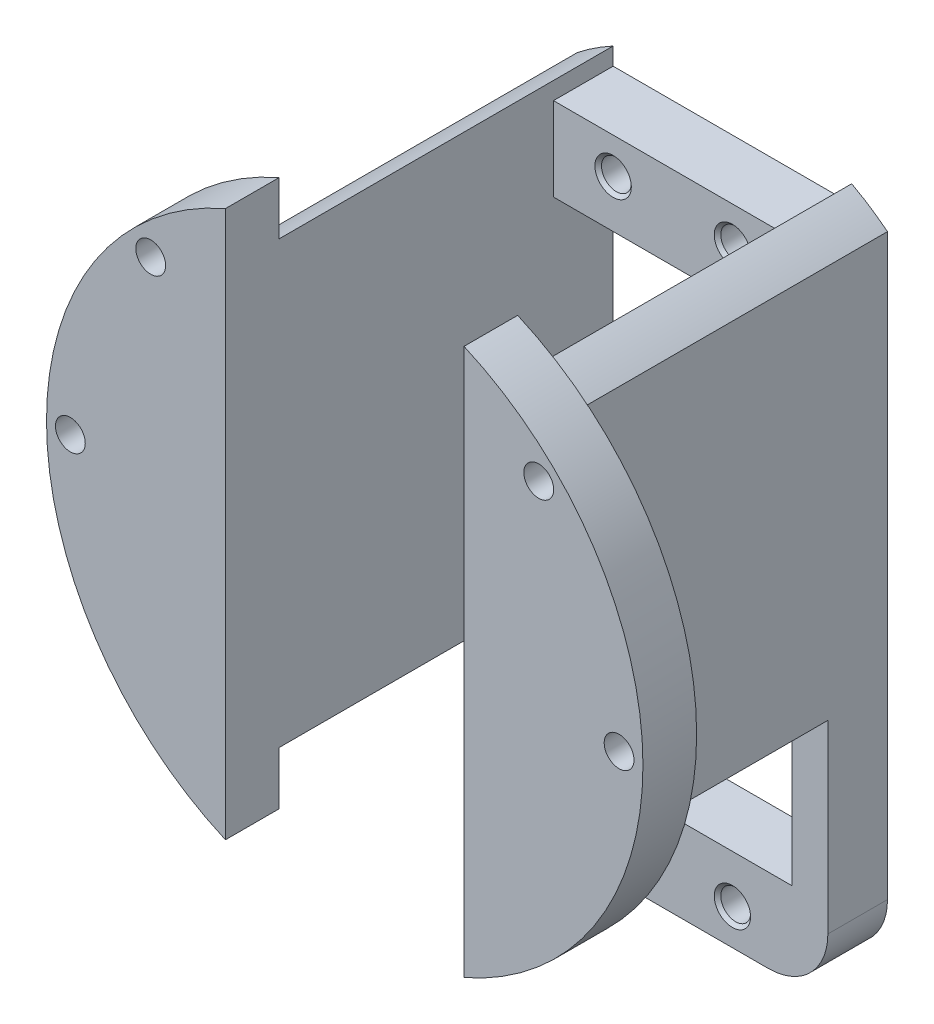
from build123d import *
from build123d.topology import SkipClean

# Parameters (mm, degrees)
SKETCH_1_W                  = 26
SKETCH_1_H                  = 54
SKETCH_1_W_2                = 20
SKETCH_1_H_2                = 40
EXTRUDE_1_DEPTH             = 5
EXTRUDE_2_DEPTH             = 28
SKETCH_3_OUTSIDE_W          = 41.47
SKETCH_3_OUTSIDE_H          = 70.936
CUT_EXTRUDE_1_DEPTH         = 49.187135213
FILLET_1_R                  = 5
EXTRUDE_3_DEPTH             = 4.5
M3X0_51_D                   = 2.5
M3X0_51_CSINK_D             = 3.05
M3X0_51_CSINK_ANGLE         = 90
PATTERN_LINEAR_1_COUNT      = 2
PATTERN_LINEAR_1_PITCH      = 10
PATTERN_LINEAR_1_COUNT_DIR2 = 2
PATTERN_LINEAR_1_PITCH_DIR2 = 48
HOLE_WIZARD_1_D             = 2.5
PATTERN_CIRCULAR_1_COUNT    = 8


with BuildPart() as part:
    # Эскиз1 → Бобышка-Вытянуть1 (new body)
    with BuildSketch(Plane.XY):
        with Locations((0, -10)):
            Rectangle(SKETCH_1_W, SKETCH_1_H)
        with Locations((0, -10)):
            Rectangle(SKETCH_1_W_2, SKETCH_1_H_2, mode=Mode.SUBTRACT)
    extrude(amount=EXTRUDE_1_DEPTH)

    # Эскиз2 → Бобышка-Вытянуть2 (add)
    with BuildSketch(Plane.XY):
        with BuildLine():
            Line((10, -18.466185313), (10, 18.466185313))
            ThreePointArc((10, 18.466185313), (11.542267321, 17.543547677), (13, 16.492422502))
            Line((13, 16.492422502), (13, -16.492422502))
            ThreePointArc((13, -16.492422502), (11.542267321, -17.543547677), (10, -18.466185313))
        make_face()
        with BuildLine():
            Line((-10, -18.466185313), (-10, 18.466185313))
            ThreePointArc((-10, 18.466185313), (-11.542267321, 17.543547677), (-13, 16.492422502))
            Line((-13, 16.492422502), (-13, -16.492422502))
            ThreePointArc((-13, -16.492422502), (-11.542267321, -17.543547677), (-10, -18.466185313))
        make_face()
    extrude(amount=EXTRUDE_2_DEPTH)

    # Эскиз3 outside → Вырез-Вытянуть1 (cut, through all)
    with SkipClean():  # the faces are left unmerged after this step: merging them gives an invalid solid
        with BuildSketch(Plane.XY.offset(28)):
            with Locations((0, -9.267)):
                Rectangle(SKETCH_3_OUTSIDE_W, SKETCH_3_OUTSIDE_H)
            with BuildLine():
                Line((-13, -16.492422502), (-13, -37))
                Line((-13, -37), (13, -37))
                Line((13, -37), (13, -16.492422502))
                ThreePointArc((13, -16.492422502), (0, 21), (-13, -16.492422502))
            make_face(mode=Mode.SUBTRACT)
        extrude(amount=-CUT_EXTRUDE_1_DEPTH, mode=Mode.SUBTRACT)

    # Скругление1
    fillet_1_edges = [part.edges().sort_by_distance(p)[0] for p in [
        (-13, -37, 2.5),
        (13, -37, 2.5),
    ]]
    fillet(fillet_1_edges, radius=FILLET_1_R)

    # Эскиз7 → Бобышка-Вытянуть3 (add)
    with BuildSketch(Plane.XY.offset(28)):
        with BuildLine():
            Line((-10, -22.912878475), (-10, 22.912878475))
            ThreePointArc((-10, 22.912878475), (-25, 0), (-10, -22.912878475))
        make_face()
        with BuildLine():
            Line((10, -22.912878475), (10, 22.912878475))
            ThreePointArc((10, 22.912878475), (25, 0), (10, -22.912878475))
        make_face()
    extrude(amount=EXTRUDE_3_DEPTH)

    # Отверстие обработанное метчиком M3x0.51 (through all)
    with Locations(Plane.XY.offset(5)):
        with Locations((-5, 14)):
            m3x0_51 = CounterSinkHole(M3X0_51_D / 2, M3X0_51_CSINK_D / 2, counter_sink_angle=M3X0_51_CSINK_ANGLE)

    # Линейный массив1: M3x0.51 2 × 2
    with Locations(*[(i * PATTERN_LINEAR_1_PITCH, -j * PATTERN_LINEAR_1_PITCH_DIR2, 0) for i in range(PATTERN_LINEAR_1_COUNT) for j in range(PATTERN_LINEAR_1_COUNT_DIR2) if (i, j) != (0, 0)]):
        add(m3x0_51, mode=Mode.SUBTRACT)

    # Отверстие1 (through all)
    with Locations(Plane.XY.offset(32.5)):
        with Locations((-23, 0)):
            hole_wizard_1 = Hole(HOLE_WIZARD_1_D / 2)

    # Круговой массив1: Отверстие1 ×8 about axis, 4 skipped
    pattern_circular_1_axis = Axis((0, 0, 32.5), (0, 0, 1))
    add([hole_wizard_1.rotate(pattern_circular_1_axis, i * 360 / PATTERN_CIRCULAR_1_COUNT) for i in range(1, PATTERN_CIRCULAR_1_COUNT) if i not in (1, 2, 3, 6)], mode=Mode.SUBTRACT)


solid = part.part
